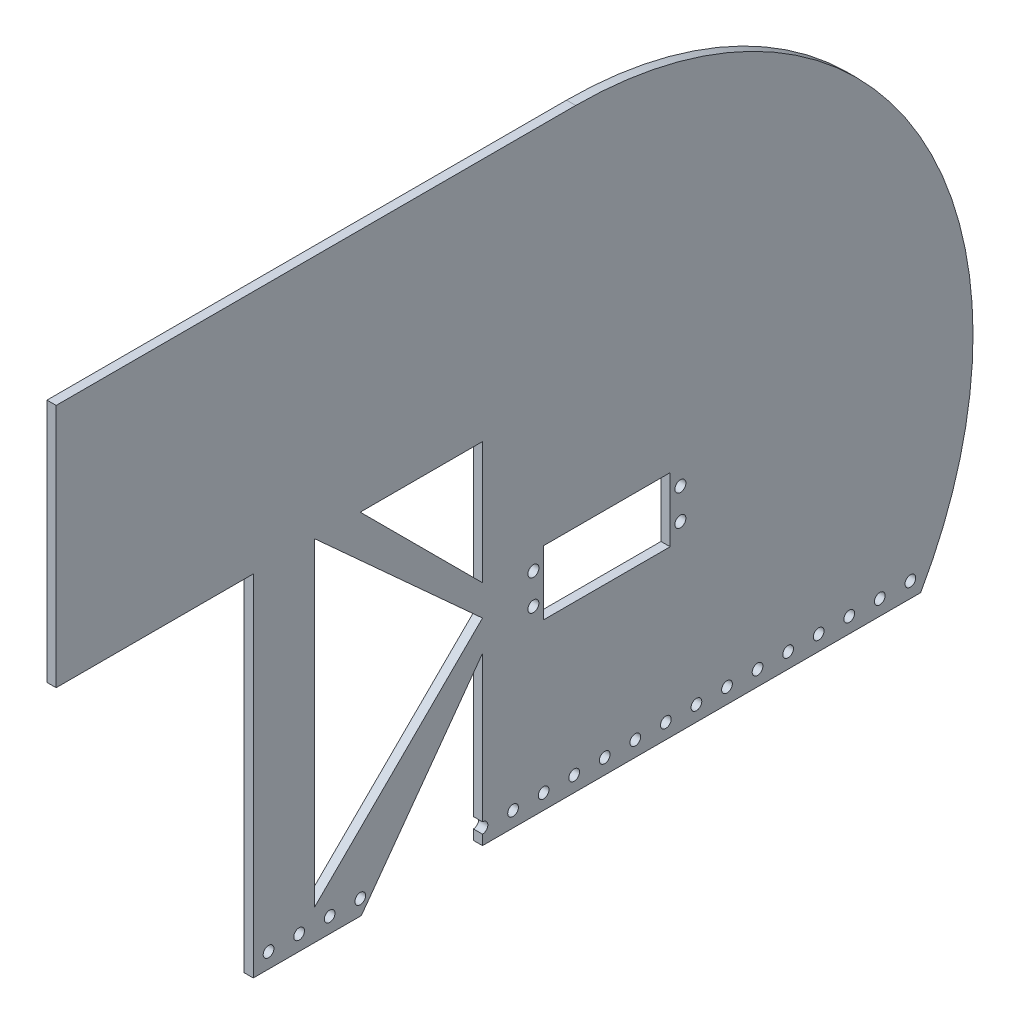
from build123d import *

# Parameters (mm, degrees)
SKETCH1_R           = 5
BOSS_EXTRUDE1_DEPTH = 3
SKETCH2_R           = 1.8
SKETCH2_W           = 41.4
SKETCH2_H           = 21
SERVOHOLE_DEPTH     = 215.030371677
SKETCH3_W           = 322.70302131
SKETCH3_H           = 65.5
CUT_EXTRUDE2_DEPTH  = 215.030371677
SKETCH4_W           = 64.5
SKETCH4_H           = 115
CUT_EXTRUDE5_DEPTH  = 215.030371677
SKETCH5_R           = 1.75
CUT_EXTRUDE6_DEPTH  = 10
LPATTERN1_COUNT     = 14
LPATTERN1_PITCH     = 10
LPATTERN2_COUNT     = 14
LPATTERN2_PITCH     = 10


with BuildPart() as part:
    # Sketch1 → Boss-Extrude1 (new body)
    with BuildSketch(Plane(origin=(0, 0, 0), x_dir=(0, 0, -1), z_dir=(1, 0, 0))):
        with BuildLine():
            Line((0, 130), (-170, 130))
            Line((-170, 130), (-170, 50))
            Line((-170, 50), (-120, 50))
            ThreePointArc((-120, 50), (72.111025509, -108.166538264), (0, 130))
        make_face()
        Circle(SKETCH1_R, mode=Mode.SUBTRACT)
    extrude(amount=BOSS_EXTRUDE1_DEPTH)

    # Sketch2 → ServoHole (cut, through all)
    with BuildSketch(Plane(origin=(3, 0, 0), x_dir=(0, 0, -1), z_dir=(1, 0, 0))):
        with Locations((-13.85, 5)):
            Circle(SKETCH2_R)
        with Locations((-13.85, -5)):
            Circle(SKETCH2_R)
        with Locations((34.25, 5)):
            Circle(SKETCH2_R)
        with Locations((34.25, -5)):
            Circle(SKETCH2_R)
        with Locations((10.2, 0)):
            Rectangle(SKETCH2_W, SKETCH2_H)
    extrude(amount=-SERVOHOLE_DEPTH, mode=Mode.SUBTRACT)

    # Sketch3 → Cut-Extrude2 (cut, through all)
    with BuildSketch(Plane(origin=(3, 0, 0), x_dir=(0, 0, -1), z_dir=(1, 0, 0))):
        with Locations((-37.404207891, -97.25)):
            Rectangle(SKETCH3_W, SKETCH3_H)
    extrude(amount=-CUT_EXTRUDE2_DEPTH, mode=Mode.SUBTRACT)

    # Sketch4 → Cut-Extrude5 (cut, through all)
    with BuildSketch(Plane(origin=(3, 0, 0), x_dir=(0, 0, -1), z_dir=(1, 0, 0))):
        with Locations((-137.75, -7.5)):
            Rectangle(SKETCH4_W, SKETCH4_H)
        Polygon((-30.5, 50), (-30.5, 10), (-70.5, 50), align=None)
        Polygon((-85.5, 50), (-30.5, 0), (-85.5, -54.5), align=None)
        Polygon((-30.5, -10), (-70.5, -65), (-30.5, -65), align=None)
    extrude(amount=-CUT_EXTRUDE5_DEPTH, mode=Mode.SUBTRACT)

    # Sketch5 → Cut-Extrude6 (cut)
    with BuildSketch(Plane(origin=(3, 0, 0), x_dir=(0, 0, -1), z_dir=(1, 0, 0))):
        with Locations((-20.5, -59.5)):
            Circle(SKETCH5_R)
    cut_extrude6 = extrude(amount=-CUT_EXTRUDE6_DEPTH, mode=Mode.SUBTRACT)

    # LPattern1: Cut-Extrude6 ×14
    with Locations(*[(0, 0, -i * LPATTERN1_PITCH) for i in range(1, LPATTERN1_COUNT)]):
        add(cut_extrude6, mode=Mode.SUBTRACT)

    # LPattern2: Cut-Extrude6 ×14
    with Locations(*[(0, 0, i * LPATTERN2_PITCH) for i in range(1, LPATTERN2_COUNT)]):
        add(cut_extrude6, mode=Mode.SUBTRACT)


solid = part.part
